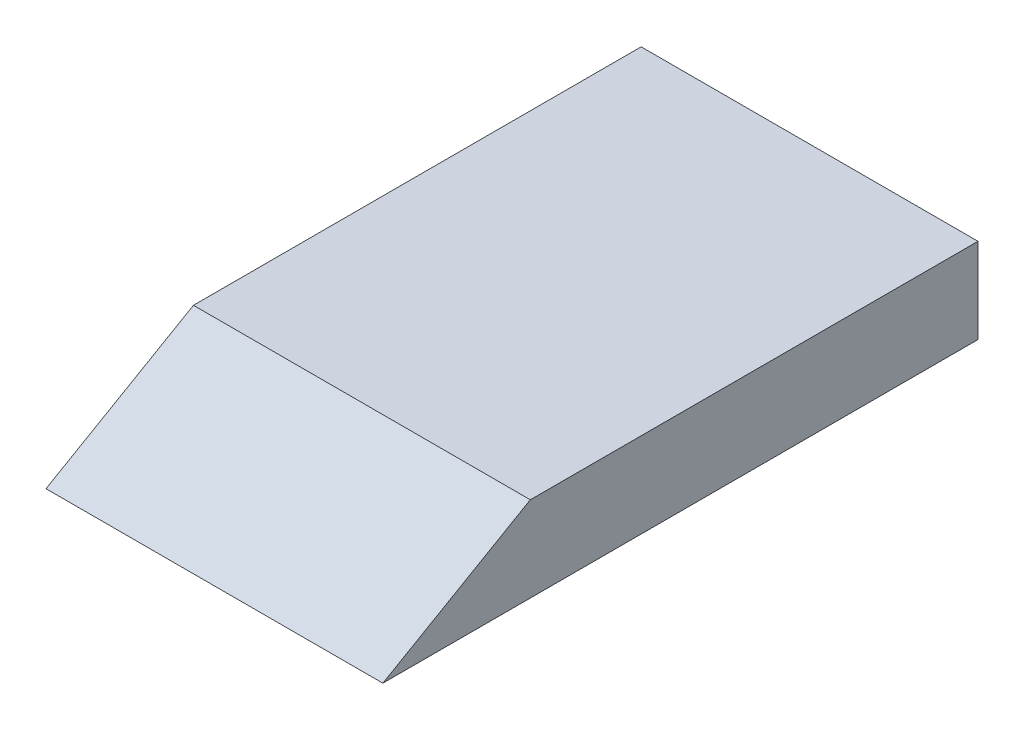
from build123d import *

# Parameters (mm, degrees)
SKETCH_1_W        = 139.197482014
SKETCH_1_H        = 35.176258993
EXTRUDE_160_DEPTH = 260
DRAFT3_START      = 122.963533898
DRAFT3_OUTLINE_W  = 139.197482014
DRAFT3_OUTLINE_H  = 86
DRAFT3_DEPTH      = 37.5


# Read off the part's stored shape, not the designer's step: Draft3
with BuildPart() as part:
    # Эскиз1 → Extrude 160 (new body)
    with BuildSketch(Plane.XY):
        with Locations((15.829316547, 17.588129497)):
            Rectangle(SKETCH_1_W, SKETCH_1_H)
    extrude(amount=EXTRUDE_160_DEPTH)

    # Draft3 outline → Draft3 (cut)
    with BuildSketch(Plane(origin=(0, 0, 0), x_dir=(1, 0, 0), z_dir=(0, 0.866025403784438, 0.500000000000001)).offset(DRAFT3_START)):
        with Locations((15.829316547, -184)):
            Rectangle(DRAFT3_OUTLINE_W, DRAFT3_OUTLINE_H)
    extrude(amount=DRAFT3_DEPTH, mode=Mode.SUBTRACT)


solid = part.part
